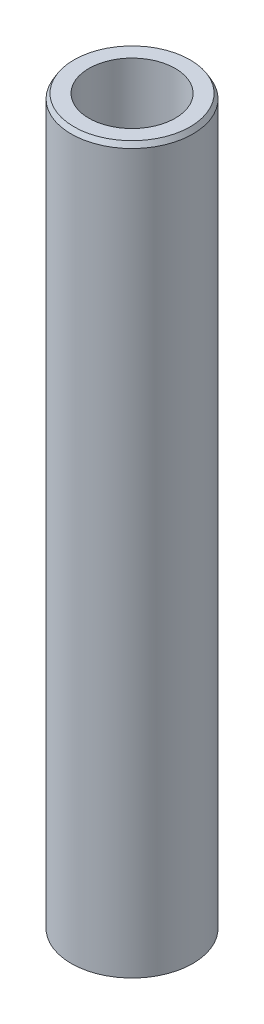
from build123d import *
from OCP.BRepFilletAPI import BRepFilletAPI_MakeChamfer

# Parameters (mm, degrees)
SKETCH1_R           = 40
BOSS_EXTRUDE1_DEPTH = 477.31309145
SKETCH2_R           = 28.390433598
CUT_EXTRUDE1_DEPTH  = 481.653500216
CHAMFER1_SIZE       = 3.173407971
CHAMFER1_SIZE2      = 1.832167946


with BuildPart() as part:
    # Sketch1 → Boss-Extrude1 (new body)
    with BuildSketch(Plane(origin=(0, 0, 0), x_dir=(1, 0, 0), z_dir=(0, 1, 0))):
        Circle(SKETCH1_R)
    extrude(amount=BOSS_EXTRUDE1_DEPTH)

    # Sketch2 → Cut-Extrude1 (cut, through all)
    with BuildSketch(Plane(origin=(0, 0, 0), x_dir=(1, 0, 0), z_dir=(0, 1, 0))):
        Circle(SKETCH2_R)
    extrude(amount=CUT_EXTRUDE1_DEPTH, mode=Mode.SUBTRACT)

    # Chamfer1: one chamfer whose edges measure the first distance from different faces: ONE call of the kernel's chamfer builder (chamfer() names one face for all edges)
    chamfer1_edges_1 = [part.edges().sort_by_distance(p)[0] for p in [
        (-40, 477.31309145, 0),
    ]]
    chamfer1_side_1 = [part.faces().sort_by_distance(p)[0] for p in [
        (-40, 238.656545725, 0),
    ]]
    chamfer1_edges_2 = [part.edges().sort_by_distance(p)[0] for p in [
        (-40, 0, 0),
    ]]
    chamfer1_side_2 = [part.faces().sort_by_distance(p)[0] for p in [
        (-38.86862915, 0, 0),
    ]]
    chamfer1 = BRepFilletAPI_MakeChamfer(part.part.solid().wrapped)
    for e in chamfer1_edges_1:
        chamfer1.Add(CHAMFER1_SIZE, CHAMFER1_SIZE2, e.wrapped, chamfer1_side_1[0].wrapped)  # the first distance lies on this face
    for e in chamfer1_edges_2:
        chamfer1.Add(CHAMFER1_SIZE, CHAMFER1_SIZE2, e.wrapped, chamfer1_side_2[0].wrapped)  # the first distance lies on this face
    add(Compound.cast(chamfer1.Shape()), mode=Mode.REPLACE)


solid = part.part
